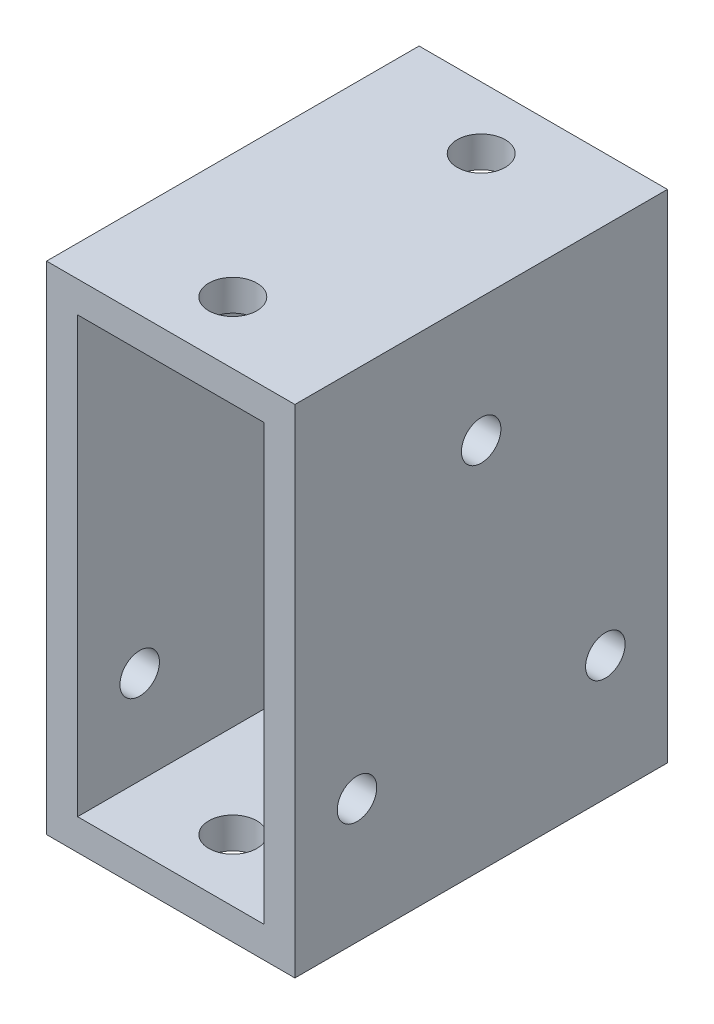
from build123d import *

# Parameters (mm, degrees)
SKETCH1_W                    = 25.4
SKETCH1_H                    = 50.8
SKETCH1_W_2                  = 19.05
SKETCH1_H_2                  = 44.45
BOSS_EXTRUDE1_DEPTH          = 19.05
F_10_0_1935_DIAMETER_HOLE1_D = 4.9149
F_10_32_TAPPED_HOLE1_D       = 4.0386


with BuildPart() as part:
    # Sketch1 → Boss-Extrude1 (new, symmetric)
    with BuildSketch(Plane.XY):
        Rectangle(SKETCH1_W, SKETCH1_H)
        Rectangle(SKETCH1_W_2, SKETCH1_H_2, mode=Mode.SUBTRACT)
    extrude(amount=BOSS_EXTRUDE1_DEPTH, both=True)

    # #10 (0.1935) Diameter Hole1 (through all)
    with Locations(Plane(origin=(0, 25.4, 0), x_dir=(1, 0, 0), z_dir=(0, 1, 0))):
        with Locations((0, -12.7), (0, 12.7)):
            Hole(F_10_0_1935_DIAMETER_HOLE1_D / 2)

    # #10-32 Tapped Hole1 (through all)
    with Locations(Plane.ZY.offset(12.7)):
        with Locations((-12.7, -12.7), (12.7, -12.7), (0, 12.7)):
            Hole(F_10_32_TAPPED_HOLE1_D / 2)


solid = part.part
